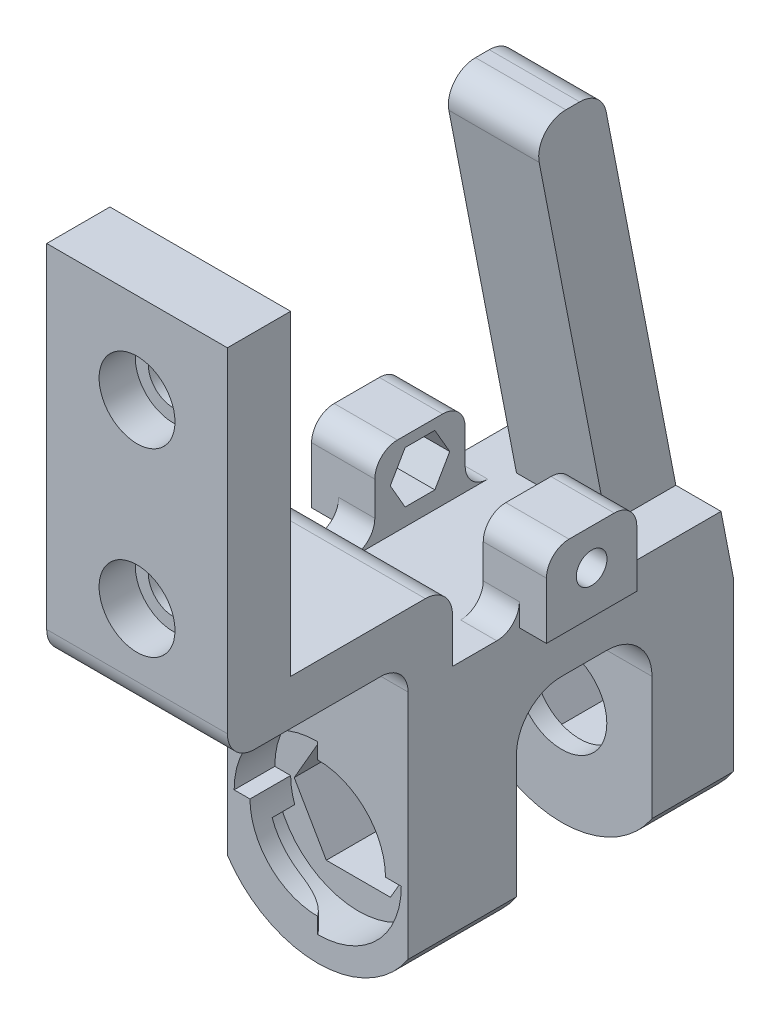
from build123d import *
from build123d.topology import SkipClean

# Parameters (mm, degrees)
BOSS_EXTRUDE1_DEPTH  = 5
CUT_EXTRUDE1_DEPTH   = 17.401219467
BOSS_EXTRUDE2_DEPTH  = 2
SKETCH6_R            = 5
BOSS_EXTRUDE3_DEPTH  = 2
SKETCH7_R            = 5
BOSS_EXTRUDE4_DEPTH  = 2
BOSS_EXTRUDE5_DEPTH  = 10
SKETCH9_R            = 7.5
CUT_EXTRUDE2_DEPTH   = 4.5
SKETCH11_R           = 9.25
CUT_EXTRUDE3_DEPTH   = 4.5
BOSS_EXTRUDE6_DEPTH  = 4.5
BOSS_EXTRUDE7_DEPTH  = 2
FILLET1_R            = 5
CUT_EXTRUDE4_START   = -4.5
SKETCH15_R           = 7.5
CUT_EXTRUDE4_DEPTH   = 4.5
BOSS_EXTRUDE8_DEPTH  = 20
FILLET2_R            = 5
SKETCH17_W           = 5
SKETCH17_H           = 9.540449769
SKETCH17_H_2         = 7.639337836
SKETCH17_H_3         = 12.1686109
CUT_EXTRUDE5_DEPTH   = 42.081359172
FILLET3_R            = 3
BOSS_EXTRUDE9_DEPTH  = 4
BOSS_EXTRUDE10_START = -4
SKETCH19_W           = 10
SKETCH19_H           = 8.75
SKETCH19_R           = 1.7
BOSS_EXTRUDE10_DEPTH = 4
BOSS_EXTRUDE11_START = 3
SKETCH20_W           = 10
SKETCH20_H           = 8.75
SKETCH20_R           = 1.7
BOSS_EXTRUDE11_DEPTH = 3
SKETCH21_W           = 10
SKETCH21_H           = 8.75
SKETCH21_R           = 1.7
BOSS_EXTRUDE12_DEPTH = 3
CUT_EXTRUDE6_DEPTH   = 4
CUT_EXTRUDE7_DEPTH   = 5
FILLET5_R            = 2.5
BOSS_EXTRUDE14_DEPTH = 20
SKETCH27_W           = 20
SKETCH27_H           = 40
BOSS_EXTRUDE16_DEPTH = 7
SKETCH28_R           = 4.2
CUT_EXTRUDE8_DEPTH   = 4
SKETCH29_R           = 2.75
CUT_EXTRUDE9_DEPTH   = 4
FILLET6_R            = 3


with BuildPart() as part:
    # Sketch2 → Boss-Extrude1 (new body)
    # profile 1 of 2: a face of its own
    with BuildSketch(Plane.XY.offset(-191.5)):
        with BuildLine():
            Line((10, 12), (0, 12))
            ThreePointArc((0, 12), (-5.674548662, 10.573528147), (-10, 6.633249581))
            Line((-10, 6.633249581), (-10, -6.633249581))
            ThreePointArc((-10, -6.633249581), (0, -12), (10, -6.633249581))
            Line((10, -6.633249581), (10, 12))
        make_face()
        Polygon((6.92820323, 0), (3.464101615, -6), (-3.464101615, -6), (-6.92820323, 0), (-3.464101615, 6), (3.464101615, 6), align=None, mode=Mode.SUBTRACT)
    # profile 2 of 2: a face of its own
    with BuildSketch(Plane.XY.offset(-191.5)):
        with BuildLine():
            ThreePointArc((-10, 6.633249581), (-5.674548662, 10.573528147), (0, 12))
            Line((0, 12), (-10, 12))
            Line((-10, 12), (-10, 6.633249581))
        make_face()
    extrude(amount=BOSS_EXTRUDE1_DEPTH)

    # Sketch3 → Cut-Extrude1 (cut, through all)
    with BuildSketch(Plane.XY.offset(-186.5)):
        Polygon((7.101408311, 0), (3.550704156, 6.15), (-3.550704156, 6.15), (-7.101408311, 0), (-3.550704156, -6.15), (3.550704156, -6.15), align=None)
    extrude(amount=-CUT_EXTRUDE1_DEPTH, mode=Mode.SUBTRACT)

    # Sketch5 → Boss-Extrude2 (add)
    with BuildSketch(Plane.XY.offset(-186.5)):
        with BuildLine():
            Line((10, 12), (-10, 12))
            Line((-10, 12), (-10, -6.633249581))
            ThreePointArc((-10, -6.633249581), (0, -12), (10, -6.633249581))
            Line((10, -6.633249581), (10, 12))
        make_face()
        Polygon((-3.550704156, -6.15), (3.550704156, -6.15), (7.101408311, 0), (3.550704156, 6.15), (-3.550704156, 6.15), (-7.101408311, 0), align=None, mode=Mode.SUBTRACT)
    extrude(amount=BOSS_EXTRUDE2_DEPTH)

    # Sketch6 → Boss-Extrude3 (add)
    with BuildSketch(Plane.XY.offset(-184.5)):
        with BuildLine():
            Line((10, -6.633249581), (10, 12))
            Line((10, 12), (-10, 12))
            Line((-10, 12), (-10, -6.633249581))
            ThreePointArc((-10, -6.633249581), (0, -12), (10, -6.633249581))
        make_face()
        Circle(SKETCH6_R, mode=Mode.SUBTRACT)
    extrude(amount=BOSS_EXTRUDE3_DEPTH)



with BuildPart() as body_2:
    # Sketch7 → Boss-Extrude4 (new body)
    with BuildSketch(Plane.XY.offset(-167.5)):
        with BuildLine():
            Line((10, -6.633249581), (10, 12))
            Line((10, 12), (-10, 12))
            Line((-10, 12), (-10, -6.633249581))
            ThreePointArc((-10, -6.633249581), (0, -12), (10, -6.633249581))
        make_face()
        Circle(SKETCH7_R, mode=Mode.SUBTRACT)
    extrude(amount=BOSS_EXTRUDE4_DEPTH)

    # Sketch8 → Boss-Extrude5 (add)
    with BuildSketch(Plane.XY.offset(-165.5)):
        with BuildLine():
            Line((10, -6.633249581), (10, 12))
            Line((10, 12), (-10, 12))
            Line((-10, 12), (-10, -6.633249581))
            ThreePointArc((-10, -6.633249581), (0, -12), (10, -6.633249581))
        make_face()
        Polygon((7.101408311, 0), (3.550704156, 6.15), (-3.550704156, 6.15), (-7.101408311, 0), (-3.550704156, -6.15), (3.550704156, -6.15), align=None, mode=Mode.SUBTRACT)
    extrude(amount=BOSS_EXTRUDE5_DEPTH)

    # Sketch9 → Cut-Extrude2 (cut)
    with BuildSketch(Plane.XY.offset(-155.5)):
        Circle(SKETCH9_R)
    extrude(amount=-CUT_EXTRUDE2_DEPTH, mode=Mode.SUBTRACT)

    # Sketch11 → Cut-Extrude3 (cut)
    with BuildSketch(Plane.XY.offset(-155.5)):
        Circle(SKETCH11_R)
    extrude(amount=-CUT_EXTRUDE3_DEPTH, mode=Mode.SUBTRACT)

    # Sketch13 → Boss-Extrude6 (add)
    with BuildSketch(Plane.XY.offset(-160)):
        with BuildLine():
            Line((5.868261699, 2.135872585), (7.101408311, 0))
            Line((7.101408311, 0), (9.25, 0))
            ThreePointArc((9.25, 0), (9.109471715, 1.606245643), (8.692156742, 3.163686326))
            Line((8.692156742, 3.163686326), (5.868261699, 2.135872585))
        make_face()
        with BuildLine():
            Line((-5.868261699, -2.135872585), (-7.101408311, 0))
            Line((-7.101408311, 0), (-9.25, 0))
            ThreePointArc((-9.25, 0), (-9.109471715, -1.606245643), (-8.692156742, -3.163686326))
            Line((-8.692156742, -3.163686326), (-5.868261699, -2.135872585))
        make_face()
    extrude(amount=BOSS_EXTRUDE6_DEPTH)

    # Sketch14 → Boss-Extrude7 (add)
    with BuildSketch(Plane.XY.offset(-155.5)):
        with BuildLine():
            Line((0, 9.25), (0, 6.15))
            Line((0, 6.15), (3.550704156, 6.15))
            Line((3.550704156, 6.15), (5.868261699, 2.135872585))
            Line((5.868261699, 2.135872585), (8.692156742, 3.163686326))
            ThreePointArc((8.692156742, 3.163686326), (5.305582036, 7.57715641), (0, 9.25))
        make_face()
        with BuildLine():
            Line((0, -9.25), (0, -6.15))
            Line((0, -6.15), (-3.550704156, -6.15))
            Line((-3.550704156, -6.15), (-5.868261699, -2.135872585))
            Line((-5.868261699, -2.135872585), (-8.692156742, -3.163686326))
            ThreePointArc((-8.692156742, -3.163686326), (-5.305582036, -7.57715641), (0, -9.25))
        make_face()
    extrude(amount=-BOSS_EXTRUDE7_DEPTH)

    # Fillet1
    # the kernel refuses this fillet: 5 mm, written as the material it takes off along each edge
    with BuildSketch(Plane(origin=(0, -19.25, -157.5), x_dir=(-1, 0, 0), z_dir=(0, 1, 0))) as fillet1_piece_1_section:
        with BuildLine():
            CenterArc((4, 5), FILLET1_R, 216.869897646, 53.130102354)
            Line((0, 2), (0, 0))
            Line((0, 0), (4, 0))
        make_face()
    fillet1_piece_1 = extrude(amount=23.1, mode=Mode.PRIVATE)
    fillet1_piece_1 = fillet1_piece_1 & Plane(origin=(0, 0, -157.389372656), x_dir=(1, 0, 0), z_dir=(0, 0, 1)) * Cylinder(9.25, 63, mode=Mode.PRIVATE)
    add(fillet1_piece_1, mode=Mode.SUBTRACT)
    with BuildSketch(Plane(origin=(0, 19.25, -157.5), x_dir=(0, 0, 1), z_dir=(0, -1, 0))) as fillet1_piece_2_section:
        with BuildLine():
            CenterArc((5, -4), FILLET1_R, 126.869897646, 53.130102354)
            Line((0, -4), (0, 0))
            Line((0, 0), (2, 0))
        make_face()
    fillet1_piece_2 = extrude(amount=23.1, mode=Mode.PRIVATE)
    fillet1_piece_2 = fillet1_piece_2 & Plane(origin=(0, 0, -157.389372656), x_dir=(1, 0, 0), z_dir=(0, 0, 1)) * Cylinder(9.25, 63, mode=Mode.PRIVATE)
    add(fillet1_piece_2, mode=Mode.SUBTRACT)

    # Sketch15 → Cut-Extrude4 (cut)
    with BuildSketch(Plane.XY.offset(-155.5).offset(CUT_EXTRUDE4_START)):
        Circle(SKETCH15_R)
    extrude(amount=CUT_EXTRUDE4_DEPTH, mode=Mode.SUBTRACT)


with BuildPart() as part_1:
    add(part.part)

    add(body_2.part)  # Boss-Extrude8 merges body 2
    # Sketch16 → Boss-Extrude8 (add)
    with BuildSketch(Plane.ZY.offset(10)):
        Polygon((-191.5, 12), (-181.959550231, 61.081359172), (-174.320212395, 61.081359172), (-182.5, 19), (-155.5, 19), (-155.5, 12), (-182.5, 12), align=None)
    extrude(amount=-BOSS_EXTRUDE8_DEPTH)

    # Fillet2
    fillet2_edges = [part_1.edges().sort_by_distance(p)[0] for p in [
        (0, 12, -167.5),
        (0, 12, -182.5),
    ]]
    fillet(fillet2_edges, radius=FILLET2_R)

    # Sketch17 → Cut-Extrude5 (cut)
    with BuildSketch(Plane(origin=(0, 61.081359172, 0), x_dir=(1, 0, 0), z_dir=(0, 1, 0))):
        with Locations((-7.5, 186.729775115)):
            Rectangle(SKETCH17_W, SKETCH17_H)
        with Locations((-7.5, 178.139881313)):
            Rectangle(SKETCH17_W, SKETCH17_H_2)
        with Locations((7.5, 178.139881313)):
            Rectangle(SKETCH17_W, SKETCH17_H_2)
        with Locations((7.5, 188.043855681)):
            Rectangle(SKETCH17_W, SKETCH17_H_3)
    extrude(amount=-CUT_EXTRUDE5_DEPTH, mode=Mode.SUBTRACT)

    # Fillet3
    fillet3_edges = [part_1.edges().sort_by_distance(p)[0] for p in [
        (0, 61.081359172, -174.320212395),
        (0, 61.081359172, -181.959550231),
    ]]
    fillet(fillet3_edges, radius=FILLET3_R)

    # Sketch18 → Boss-Extrude9 (add)
    with BuildSketch(Plane.ZY.offset(10)):
        with BuildLine():
            Line((-172.819668918, 19.75), (-172.819668918, 19))
            Line((-172.819668918, 19), (-167.819668918, 19))
            Line((-167.819668918, 19), (-167.819668918, 27.75))
            Line((-167.819668918, 27.75), (-172.819668918, 27.75))
            Line((-172.819668918, 27.75), (-172.819668918, 25.45))
            ThreePointArc((-172.819668918, 25.45), (-171.61758739, 24.952081528), (-171.119668918, 23.75))
            ThreePointArc((-171.119668918, 23.75), (-171.61758739, 22.547918472), (-172.819668918, 22.05))
            Line((-172.819668918, 22.05), (-172.819668918, 19.75))
        make_face()
        with BuildLine():
            Line((-177.819668918, 19), (-172.819668918, 19))
            Line((-172.819668918, 19), (-172.819668918, 19.75))
            Line((-172.819668918, 19.75), (-172.819668918, 22.05))
            ThreePointArc((-172.819668918, 22.05), (-174.519668918, 23.75), (-172.819668918, 25.45))
            Line((-172.819668918, 25.45), (-172.819668918, 27.75))
            Line((-172.819668918, 27.75), (-177.819668918, 27.75))
            Line((-177.819668918, 27.75), (-177.819668918, 19))
        make_face()
    extrude(amount=-BOSS_EXTRUDE9_DEPTH)

    # Sketch19 → Boss-Extrude10 (add)
    with BuildSketch(Plane(origin=(10, 0, 0), x_dir=(0, 0, -1), z_dir=(1, 0, 0)).offset(BOSS_EXTRUDE10_START)):
        with Locations((172.819668918, 23.375)):
            Rectangle(SKETCH19_W, SKETCH19_H)
        with Locations(Location((172.819668918, 23.75, 0), (0, 0, 180))):
            Circle(SKETCH19_R, mode=Mode.SUBTRACT)
    extrude(amount=BOSS_EXTRUDE10_DEPTH)

    # Sketch20 → Boss-Extrude11 (add)
    with SkipClean():  # the faces are left unmerged after this step: merging them gives an invalid solid
        with BuildSketch(Plane.ZY.offset(10).offset(BOSS_EXTRUDE11_START)):
            with Locations((-172.819668918, 23.375)):
                Rectangle(SKETCH20_W, SKETCH20_H)
            with Locations((-172.819668918, 23.75)):
                Circle(SKETCH20_R, mode=Mode.SUBTRACT)
        extrude(amount=-BOSS_EXTRUDE11_DEPTH)

    # Sketch21 → Boss-Extrude12 (add)
    with SkipClean():  # the faces are left unmerged after this step: merging them gives an invalid solid
        with BuildSketch(Plane(origin=(10, 0, 0), x_dir=(0, 0, -1), z_dir=(1, 0, 0))):
            with Locations((172.819668918, 23.375)):
                Rectangle(SKETCH21_W, SKETCH21_H)
            with Locations(Location((172.819668918, 23.75, 0), (0, 0, 180))):
                Circle(SKETCH21_R, mode=Mode.SUBTRACT)
        extrude(amount=BOSS_EXTRUDE12_DEPTH)

    # Sketch22 → Cut-Extrude6 (cut)
    with SkipClean():  # the faces are left unmerged after this step: merging them gives an invalid solid
        with BuildSketch(Plane.ZY.offset(-6)):
            Polygon((-169.528772384, 23.75), (-171.174220651, 26.6), (-174.465117185, 26.6), (-176.110565452, 23.75), (-174.465117185, 20.9), (-171.174220651, 20.9), align=None)
        extrude(amount=-CUT_EXTRUDE6_DEPTH, mode=Mode.SUBTRACT)

    # Sketch23 → Cut-Extrude7 (cut)
    with BuildSketch(Plane(origin=(-6, 0, 0), x_dir=(0, 0, -1), z_dir=(1, 0, 0))):
        Polygon((169.528772384, 23.75), (171.174220651, 26.6), (174.465117185, 26.6), (176.110565452, 23.75), (174.465117185, 20.9), (171.174220651, 20.9), align=None)
    extrude(amount=-CUT_EXTRUDE7_DEPTH, mode=Mode.SUBTRACT)

    # Fillet5
    fillet5_edges = [part_1.edges().sort_by_distance(p)[0] for p in [
        (-8, 19, -177.819668918),
        (-9.5, 27.75, -177.819668918),
        (-9.5, 27.75, -167.819668918),
        (-8, 19, -167.819668918),
        (8, 19, -177.819668918),
        (8, 19, -167.819668918),
        (9.5, 27.75, -167.819668918),
        (9.5, 27.75, -177.819668918),
    ]]
    fillet(fillet5_edges, radius=FILLET5_R)

    # Sketch25 → Boss-Extrude14 (add)
    with BuildSketch(Plane.ZY.offset(10)):
        Polygon((-160.409834459, 19), (-160.409834459, 27), (-139.5, 27), (-139.5, 62), (-135.5, 62), (-135.5, 22), (-155.5, 22), (-155.5, 19), align=None)
    extrude(amount=-BOSS_EXTRUDE14_DEPTH)

    # Sketch27 → Boss-Extrude16 (add)
    with BuildSketch(Plane.XY.offset(-135.5)):
        with Locations((0, 42)):
            Rectangle(SKETCH27_W, SKETCH27_H)
    extrude(amount=-BOSS_EXTRUDE16_DEPTH)

    # Sketch28 → Cut-Extrude8 (cut)
    with BuildSketch(Plane.XY.offset(-135.5)):
        with Locations((0, 32)):
            Circle(SKETCH28_R)
        with Locations((0, 52)):
            Circle(SKETCH28_R)
    extrude(amount=-CUT_EXTRUDE8_DEPTH, mode=Mode.SUBTRACT)

    # Sketch29 → Cut-Extrude9 (cut)
    with BuildSketch(Plane.XY.offset(-139.5)):
        with Locations((0, 32)):
            Circle(SKETCH29_R)
        with Locations((0, 52)):
            Circle(SKETCH29_R)
    extrude(amount=-CUT_EXTRUDE9_DEPTH, mode=Mode.SUBTRACT)

    # Fillet6
    fillet6_edges = [part_1.edges().sort_by_distance(p)[0] for p in [
        (0, 22, -155.5),
        (0, 22, -135.5),
        (0, 27, -160.409834459),
    ]]
    fillet(fillet6_edges, radius=FILLET6_R)


solid = part_1.part
